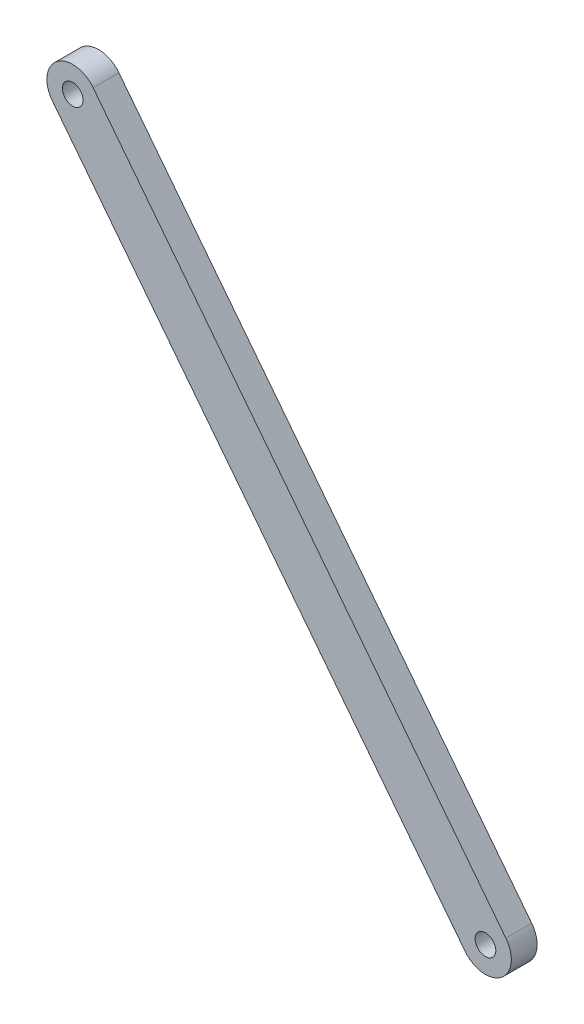
from build123d import *

# Parameters (mm, degrees)
BOSS_EXTRUDE1_START = 5
SKETCH1_R           = 2
BOSS_EXTRUDE1_DEPTH = 5


with BuildPart() as part:
    # Sketch1 → Boss-Extrude1 (new body)
    with BuildSketch(Plane.XY.offset(BOSS_EXTRUDE1_START)):
        with BuildLine():
            Line((-95.894770843, 150.07126536), (-16.027512731, 47.49826169))
            ThreePointArc((-16.027512731, 47.49826169), (-16.900810638, 40.481328545), (-23.917743783, 41.354626451))
            Line((-23.917743783, 41.354626451), (-103.785001894, 143.927630121))
            ThreePointArc((-103.785001894, 143.927630121), (-102.911703988, 150.944563266), (-95.894770843, 150.07126536))
        make_face()
        with Locations((-19.972628257, 44.426444071)):
            Circle(SKETCH1_R, mode=Mode.SUBTRACT)
        with Locations((-99.839886368, 146.99944774)):
            Circle(SKETCH1_R, mode=Mode.SUBTRACT)
    extrude(amount=BOSS_EXTRUDE1_DEPTH)


solid = part.part
